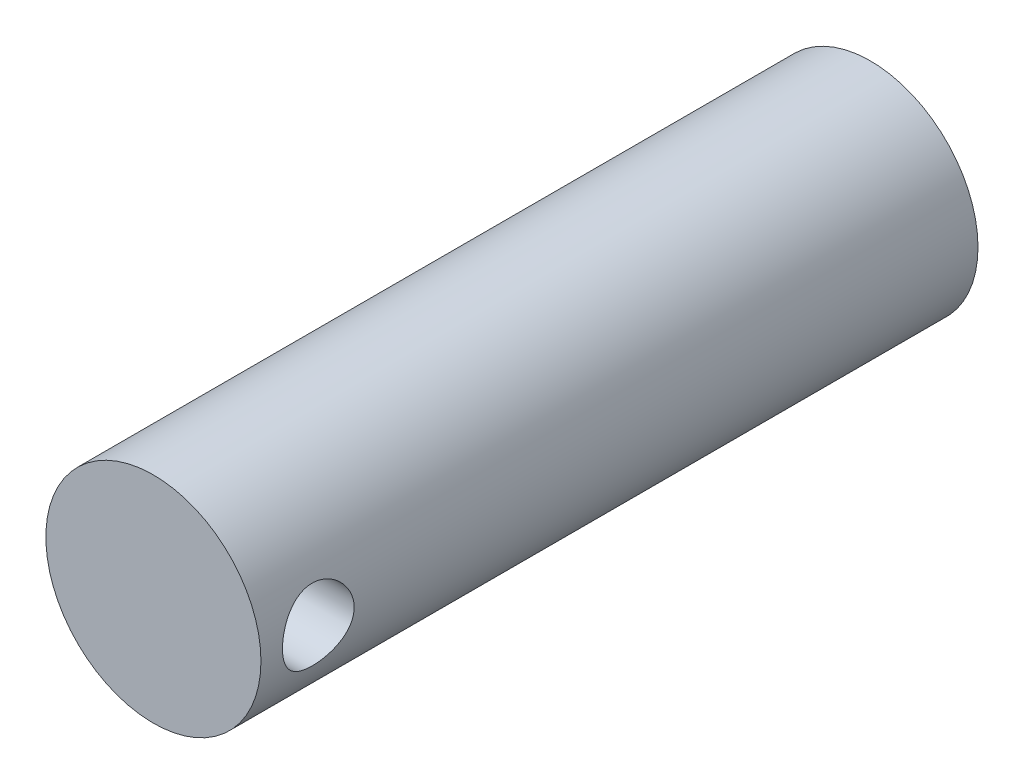
from build123d import *

# Parameters (mm, degrees)
SKETCH1_R           = 7.5
BOSS_EXTRUDE1_DEPTH = 50
SKETCH2_R           = 2.5
CUT_EXTRUDE1_DEPTH  = 25


with BuildPart() as part:
    # Sketch1 → Boss-Extrude1 (new body)
    with BuildSketch(Plane.XY):
        Circle(SKETCH1_R)
    extrude(amount=BOSS_EXTRUDE1_DEPTH)

    # Sketch2 → Cut-Extrude1 (cut, symmetric)
    with BuildSketch(Plane(origin=(0, 0, 0), x_dir=(0, 0, -1), z_dir=(1, 0, 0))):
        with Locations((-46, 0)):
            Circle(SKETCH2_R)
    extrude(amount=CUT_EXTRUDE1_DEPTH, both=True, mode=Mode.SUBTRACT)


solid = part.part
